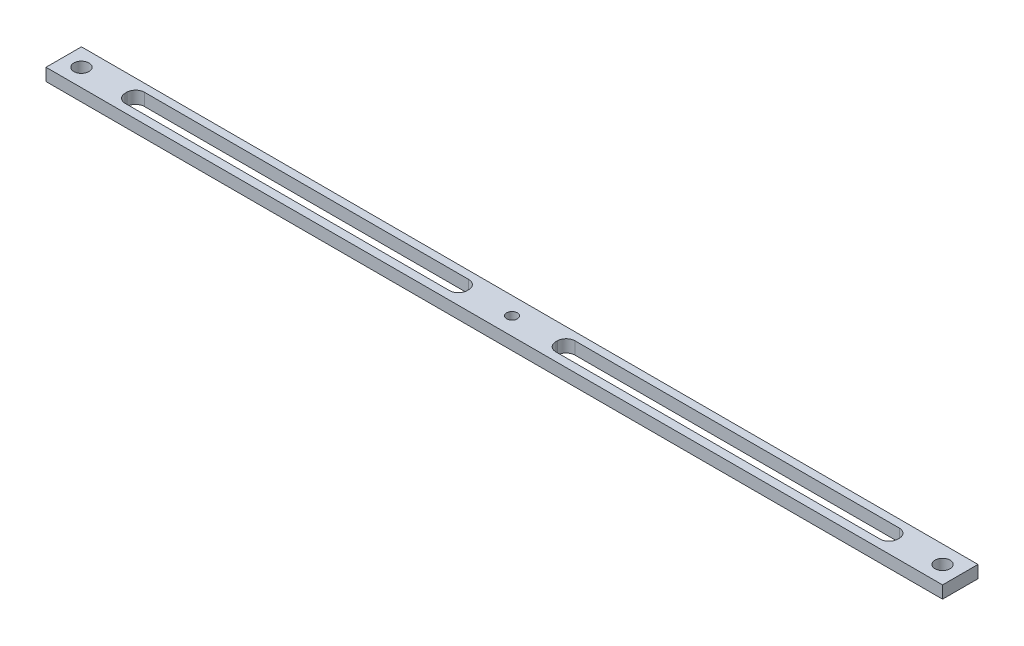
from build123d import *

# Parameters (mm, degrees)
SZKIC1_R                    = 4.25
DODANIE_WYCI_GNI_CIE1_DEPTH = 7


with BuildPart() as part:
    # Szkic1 → Dodanie-wyciągnięcie1 (new body)
    with BuildSketch(Plane(origin=(0, 0, 0), x_dir=(1, 0, 0), z_dir=(0, 1, 0))):
        Polygon((0, 0), (253, 0), (506, 0), (506, 10), (506, 20), (0, 20), (0, 10), align=None)
        with BuildLine():
            ThreePointArc((256, 10), (255.121320344, 7.878679656), (253, 7))
            ThreePointArc((253, 7), (250.878679656, 12.121320344), (256, 10))
        make_face(mode=Mode.SUBTRACT)
        with Locations((496, 10)):
            Circle(SZKIC1_R, mode=Mode.SUBTRACT)
        with BuildLine():
            ThreePointArc((14.25, 10), (10, 5.75), (5.75, 10))
            ThreePointArc((5.75, 10), (10, 14.25), (14.25, 10))
        make_face(mode=Mode.SUBTRACT)
        with BuildLine():
            ThreePointArc((35, 10.57457628), (36.464466094, 14.110110186), (40, 15.57457628))
            Line((40, 15.57457628), (223, 15.57457628))
            ThreePointArc((223, 15.57457628), (226.535533906, 14.110110186), (228, 10.57457628))
            Line((228, 10.57457628), (228, 9.696719379))
            ThreePointArc((228, 9.696719379), (226.535533906, 6.161185473), (223, 4.696719379))
            Line((223, 4.696719379), (40, 4.696719379))
            ThreePointArc((40, 4.696719379), (36.464466094, 6.161185473), (35, 9.696719379))
            Line((35, 9.696719379), (35, 10.57457628))
        make_face(mode=Mode.SUBTRACT)
        with BuildLine():
            ThreePointArc((278, 10.57457628), (279.464466094, 14.110110186), (283, 15.57457628))
            Line((283, 15.57457628), (466, 15.57457628))
            ThreePointArc((466, 15.57457628), (469.535533906, 14.110110186), (471, 10.57457628))
            Line((471, 10.57457628), (471, 9.752776346))
            ThreePointArc((471, 9.752776346), (469.535533906, 6.21724244), (466, 4.752776346))
            Line((466, 4.752776346), (283, 4.752776346))
            ThreePointArc((283, 4.752776346), (279.464466094, 6.21724244), (278, 9.752776346))
            Line((278, 9.752776346), (278, 10.57457628))
        make_face(mode=Mode.SUBTRACT)
    extrude(amount=DODANIE_WYCI_GNI_CIE1_DEPTH)


solid = part.part
